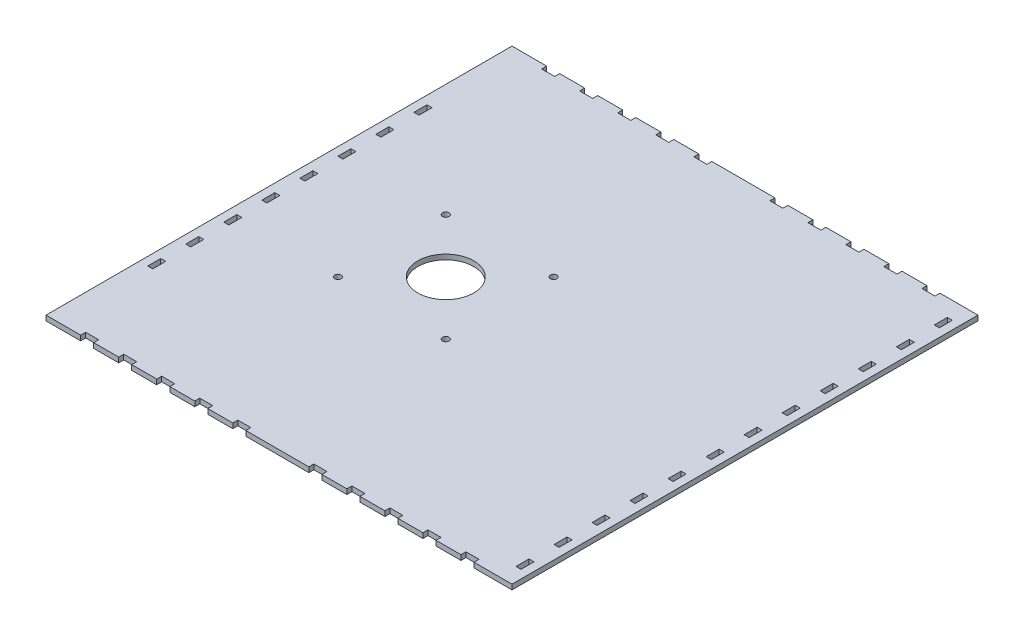
from build123d import *

# Parameters (mm, degrees)
SKETCH1_W                = 279.4
SKETCH1_H                = 279.4
BOSS_EXTRUDE1_DEPTH      = 3
SKETCH3_W                = 3
SKETCH3_H                = 7.8
CUT_EXTRUDE2_DEPTH       = 198.588410591
LPATTERN1_COUNT          = 12
LPATTERN1_PITCH          = 22.8
SKETCH5_W                = 7.8
SKETCH5_H                = 3
CUT_EXTRUDE3_DEPTH       = 198.588410591
LPATTERN2_COUNT          = 11
LPATTERN2_PITCH          = 22.8
MIRROR2_COPY_1_SKETCH_W  = 7.8
MIRROR2_COPY_1_SKETCH_H  = 3
MIRROR2_COPY_1_DEPTH     = 198.588410591
MIRROR2_COPY_2_SKETCH_W  = 7.8
MIRROR2_COPY_2_SKETCH_H  = 3
MIRROR2_COPY_2_DEPTH     = 198.588410591
MIRROR2_COPY_3_SKETCH_W  = 7.8
MIRROR2_COPY_3_SKETCH_H  = 3
MIRROR2_COPY_3_DEPTH     = 198.588410591
MIRROR2_COPY_4_SKETCH_W  = 7.8
MIRROR2_COPY_4_SKETCH_H  = 3
MIRROR2_COPY_4_DEPTH     = 198.588410591
MIRROR2_COPY_5_SKETCH_W  = 7.8
MIRROR2_COPY_5_SKETCH_H  = 3
MIRROR2_COPY_5_DEPTH     = 198.588410591
MIRROR2_COPY_6_SKETCH_W  = 7.8
MIRROR2_COPY_6_SKETCH_H  = 3
MIRROR2_COPY_6_DEPTH     = 198.588410591
MIRROR2_COPY_7_SKETCH_W  = 7.8
MIRROR2_COPY_7_SKETCH_H  = 3
MIRROR2_COPY_7_DEPTH     = 198.588410591
MIRROR2_COPY_8_SKETCH_W  = 7.8
MIRROR2_COPY_8_SKETCH_H  = 3
MIRROR2_COPY_8_DEPTH     = 198.588410591
MIRROR2_COPY_9_SKETCH_W  = 7.8
MIRROR2_COPY_9_SKETCH_H  = 3
MIRROR2_COPY_9_DEPTH     = 198.588410591
MIRROR2_COPY_10_SKETCH_W = 7.8
MIRROR2_COPY_10_SKETCH_H = 3
MIRROR2_COPY_10_DEPTH    = 198.588410591
SKETCH6_W                = 3
SKETCH6_H                = 7.8
CUT_EXTRUDE4_DEPTH       = 198.588410591
LPATTERN3_COUNT          = 8
LPATTERN3_PITCH          = 22.8
SKETCH7_R                = 16.75
SKETCH7_R_2              = 1.95
CUT_EXTRUDE5_DEPTH       = 198.588410591


with BuildPart() as part:
    # Sketch1 → Boss-Extrude1 (new body)
    with BuildSketch(Plane(origin=(0, 0, 0), x_dir=(1, 0, 0), z_dir=(0, 1, 0))):
        Rectangle(SKETCH1_W, SKETCH1_H)
    extrude(amount=BOSS_EXTRUDE1_DEPTH)

    # Sketch3 → Cut-Extrude2 (cut, through all)
    with BuildSketch(Plane(origin=(0, 0, 0), x_dir=(-1, 0, 0), z_dir=(0, -1, 0))):
        with Locations((-133.2, 125.4)):
            Rectangle(SKETCH3_W, SKETCH3_H)
    cut_extrude2 = extrude(amount=-CUT_EXTRUDE2_DEPTH, mode=Mode.SUBTRACT)

    # LPattern1: Cut-Extrude2 ×12
    with Locations(*[(0, 0, i * LPATTERN1_PITCH) for i in range(1, LPATTERN1_COUNT)]):
        add(cut_extrude2, mode=Mode.SUBTRACT)

    # Sketch5 → Cut-Extrude3 (cut, through all)
    with BuildSketch(Plane.XZ):
        with Locations((113, -138.2)):
            Rectangle(SKETCH5_W, SKETCH5_H)
    cut_extrude3 = extrude(amount=-CUT_EXTRUDE3_DEPTH, mode=Mode.SUBTRACT)

    # LPattern2: Cut-Extrude3 ×11, 1 skipped
    with Locations(*[(-i * LPATTERN2_PITCH, 0, 0) for i in range(1, LPATTERN2_COUNT) if i not in (5,)]):
        add(cut_extrude3, mode=Mode.SUBTRACT)

    # Mirror2 copy 1 sketch → Mirror2 copy 1 (cut, through all)
    with BuildSketch(Plane(origin=(-22.8, 0, 0), x_dir=(1, 0, 0), z_dir=(0, -1, 0))):
        with Locations((113, 138.2)):
            Rectangle(MIRROR2_COPY_1_SKETCH_W, MIRROR2_COPY_1_SKETCH_H)
    extrude(amount=-MIRROR2_COPY_1_DEPTH, mode=Mode.SUBTRACT)

    # Mirror2 copy 2 sketch → Mirror2 copy 2 (cut, through all)
    with BuildSketch(Plane(origin=(-45.6, 0, 0), x_dir=(1, 0, 0), z_dir=(0, -1, 0))):
        with Locations((113, 138.2)):
            Rectangle(MIRROR2_COPY_2_SKETCH_W, MIRROR2_COPY_2_SKETCH_H)
    extrude(amount=-MIRROR2_COPY_2_DEPTH, mode=Mode.SUBTRACT)

    # Mirror2 copy 3 sketch → Mirror2 copy 3 (cut, through all)
    with BuildSketch(Plane(origin=(-68.4, 0, 0), x_dir=(1, 0, 0), z_dir=(0, -1, 0))):
        with Locations((113, 138.2)):
            Rectangle(MIRROR2_COPY_3_SKETCH_W, MIRROR2_COPY_3_SKETCH_H)
    extrude(amount=-MIRROR2_COPY_3_DEPTH, mode=Mode.SUBTRACT)

    # Mirror2 copy 4 sketch → Mirror2 copy 4 (cut, through all)
    with BuildSketch(Plane(origin=(-91.2, 0, 0), x_dir=(1, 0, 0), z_dir=(0, -1, 0))):
        with Locations((113, 138.2)):
            Rectangle(MIRROR2_COPY_4_SKETCH_W, MIRROR2_COPY_4_SKETCH_H)
    extrude(amount=-MIRROR2_COPY_4_DEPTH, mode=Mode.SUBTRACT)

    # Mirror2 copy 5 sketch → Mirror2 copy 5 (cut, through all)
    with BuildSketch(Plane(origin=(-136.8, 0, 0), x_dir=(1, 0, 0), z_dir=(0, -1, 0))):
        with Locations((113, 138.2)):
            Rectangle(MIRROR2_COPY_5_SKETCH_W, MIRROR2_COPY_5_SKETCH_H)
    extrude(amount=-MIRROR2_COPY_5_DEPTH, mode=Mode.SUBTRACT)

    # Mirror2 copy 6 sketch → Mirror2 copy 6 (cut, through all)
    with BuildSketch(Plane(origin=(-159.6, 0, 0), x_dir=(1, 0, 0), z_dir=(0, -1, 0))):
        with Locations((113, 138.2)):
            Rectangle(MIRROR2_COPY_6_SKETCH_W, MIRROR2_COPY_6_SKETCH_H)
    extrude(amount=-MIRROR2_COPY_6_DEPTH, mode=Mode.SUBTRACT)

    # Mirror2 copy 7 sketch → Mirror2 copy 7 (cut, through all)
    with BuildSketch(Plane(origin=(-182.4, 0, 0), x_dir=(1, 0, 0), z_dir=(0, -1, 0))):
        with Locations((113, 138.2)):
            Rectangle(MIRROR2_COPY_7_SKETCH_W, MIRROR2_COPY_7_SKETCH_H)
    extrude(amount=-MIRROR2_COPY_7_DEPTH, mode=Mode.SUBTRACT)

    # Mirror2 copy 8 sketch → Mirror2 copy 8 (cut, through all)
    with BuildSketch(Plane(origin=(-205.2, 0, 0), x_dir=(1, 0, 0), z_dir=(0, -1, 0))):
        with Locations((113, 138.2)):
            Rectangle(MIRROR2_COPY_8_SKETCH_W, MIRROR2_COPY_8_SKETCH_H)
    extrude(amount=-MIRROR2_COPY_8_DEPTH, mode=Mode.SUBTRACT)

    # Mirror2 copy 9 sketch → Mirror2 copy 9 (cut, through all)
    with BuildSketch(Plane(origin=(-228, 0, 0), x_dir=(1, 0, 0), z_dir=(0, -1, 0))):
        with Locations((113, 138.2)):
            Rectangle(MIRROR2_COPY_9_SKETCH_W, MIRROR2_COPY_9_SKETCH_H)
    extrude(amount=-MIRROR2_COPY_9_DEPTH, mode=Mode.SUBTRACT)

    # Mirror2 copy 10 sketch → Mirror2 copy 10 (cut, through all)
    with BuildSketch(Plane.XZ):
        with Locations((113, 138.2)):
            Rectangle(MIRROR2_COPY_10_SKETCH_W, MIRROR2_COPY_10_SKETCH_H)
    extrude(amount=-MIRROR2_COPY_10_DEPTH, mode=Mode.SUBTRACT)

    # Sketch6 → Cut-Extrude4 (cut, through all)
    with BuildSketch(Plane.XZ):
        with Locations((-133.2, -79.8)):
            Rectangle(SKETCH6_W, SKETCH6_H)
    cut_extrude4 = extrude(amount=-CUT_EXTRUDE4_DEPTH, mode=Mode.SUBTRACT)

    # LPattern3: Cut-Extrude4 ×8
    with Locations(*[(0, 0, i * LPATTERN3_PITCH) for i in range(1, LPATTERN3_COUNT)]):
        add(cut_extrude4, mode=Mode.SUBTRACT)

    # Sketch7 → Cut-Extrude5 (cut, through all)
    with BuildSketch(Plane(origin=(0, 0, 0), x_dir=(-1, 0, 0), z_dir=(0, -1, 0))):
        with Locations((39.7, 0)):
            Circle(SKETCH7_R)
        with Locations((72.025, -32.325)):
            Circle(SKETCH7_R_2)
        with Locations((7.375, -32.325)):
            Circle(SKETCH7_R_2)
        with Locations((72.025, 32.325)):
            Circle(SKETCH7_R_2)
        with Locations((7.375, 32.325)):
            Circle(SKETCH7_R_2)
    extrude(amount=-CUT_EXTRUDE5_DEPTH, mode=Mode.SUBTRACT)


solid = part.part
